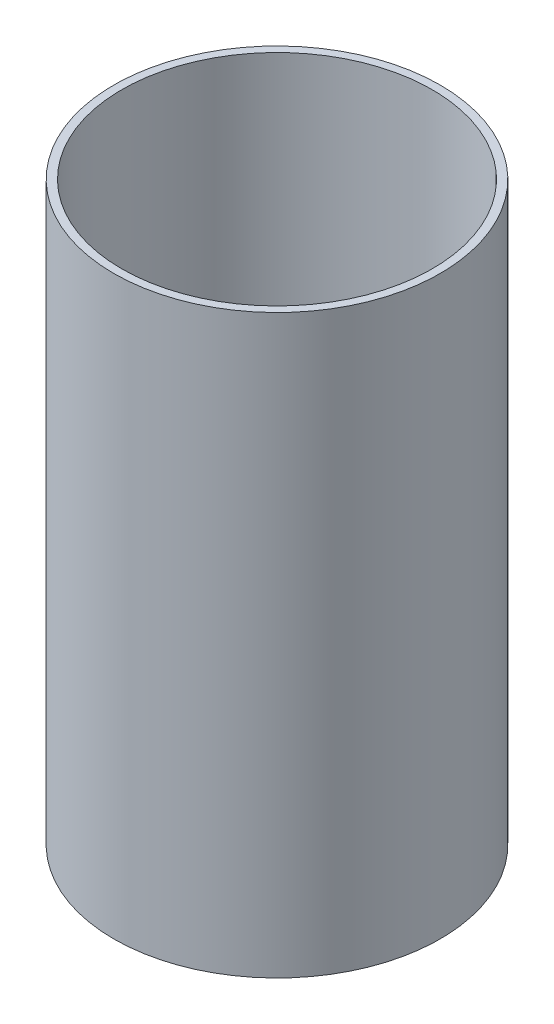
from build123d import *

# Parameters (mm, degrees)
SKETCH1_R   = 25.4
SKETCH1_R_2 = 24.1554
BODY_DEPTH  = 89.6872857
SKETCH2_W   = 1.87325
SKETCH2_H   = 1.7272


with BuildPart() as part:
    # Sketch1 → body (new body)
    with BuildSketch(Plane(origin=(0, 0, 0), x_dir=(1, 0, 0), z_dir=(0, 1, 0))):
        Circle(SKETCH1_R)
        Circle(SKETCH1_R_2, mode=Mode.SUBTRACT)
    extrude(amount=BODY_DEPTH)

    # Sketch2 → Cut-Revolve1 (revolve, cut)
    with BuildSketch(Plane.XY):
        with Locations((23.955375, 7.2136)):
            Rectangle(SKETCH2_W, SKETCH2_H)
    revolve(axis=Axis((0, 0, 0), (0, 1, 0)), mode=Mode.SUBTRACT)


solid = part.part
